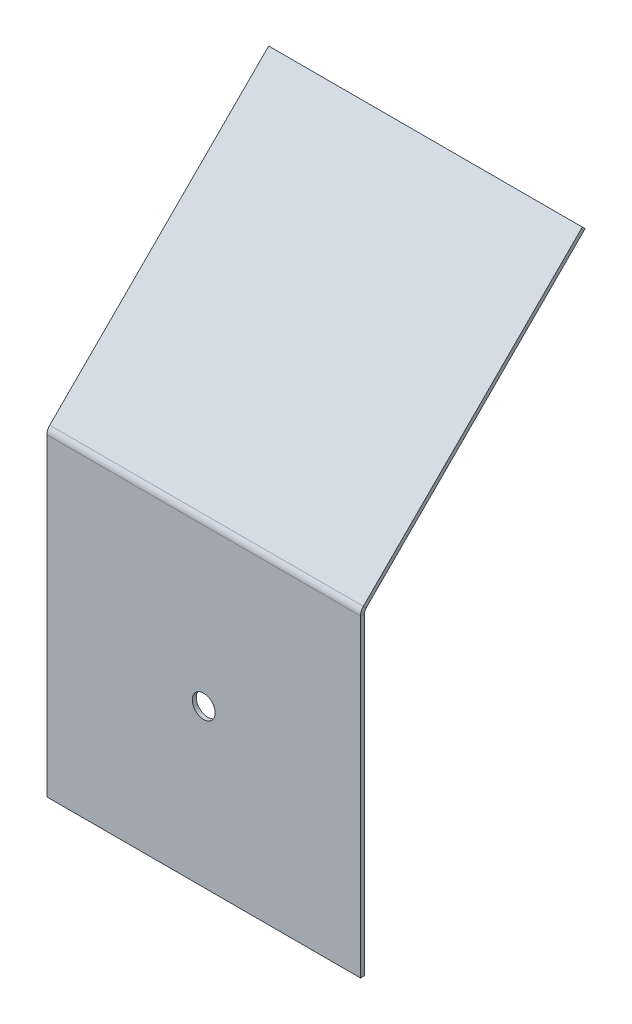
from build123d import *

# Parameters (mm, degrees)
SKETCH1_W          = 55
SKETCH1_H          = 55
BASE_FLANGE1_DEPTH = 0.7
EDGE_FLANGE1_DEPTH = 55
SKETCH10_R         = 2
CUT_EXTRUDE1_DEPTH = 10


# Sheet-metal steps are written as plain solids
with BuildPart() as part:
    # Sketch1 → Base-Flange1 (new body)
    with BuildSketch(Plane.XY):
        Rectangle(SKETCH1_W, SKETCH1_H)
    extrude(amount=-BASE_FLANGE1_DEPTH)

    # Edge-Flange1 section (across the edge) → Edge-Flange1 (add)
    with BuildSketch(Plane(origin=(-27.5, 27.914213562, -0.7), x_dir=(0, -0.7071067811865438, -0.7071067811865512), z_dir=(1, 0, 0))):
        with BuildLine():
            Line((-0.7, 0.414213562), (-0.7, 54.710050506))
            Line((-0.7, 54.710050506), (0, 54.710050506))
            Line((0, 54.710050506), (0, 0.414213562))
            ThreePointArc((0, 0.414213562), (0.076120467, 0.03153013), (0.292893219, -0.292893219))
            Line((0.292893219, -0.292893219), (-0.202081528, -0.787867966))
            ThreePointArc((-0.202081528, -0.787867966), (-0.570595205, -0.236348273), (-0.7, 0.414213562))
        make_face()
    extrude(amount=EDGE_FLANGE1_DEPTH)

    # Sketch10 → Cut-Extrude1 (cut)
    with BuildSketch(Plane.XY):
        Circle(SKETCH10_R)
    extrude(amount=-CUT_EXTRUDE1_DEPTH, mode=Mode.SUBTRACT)


solid = part.part
